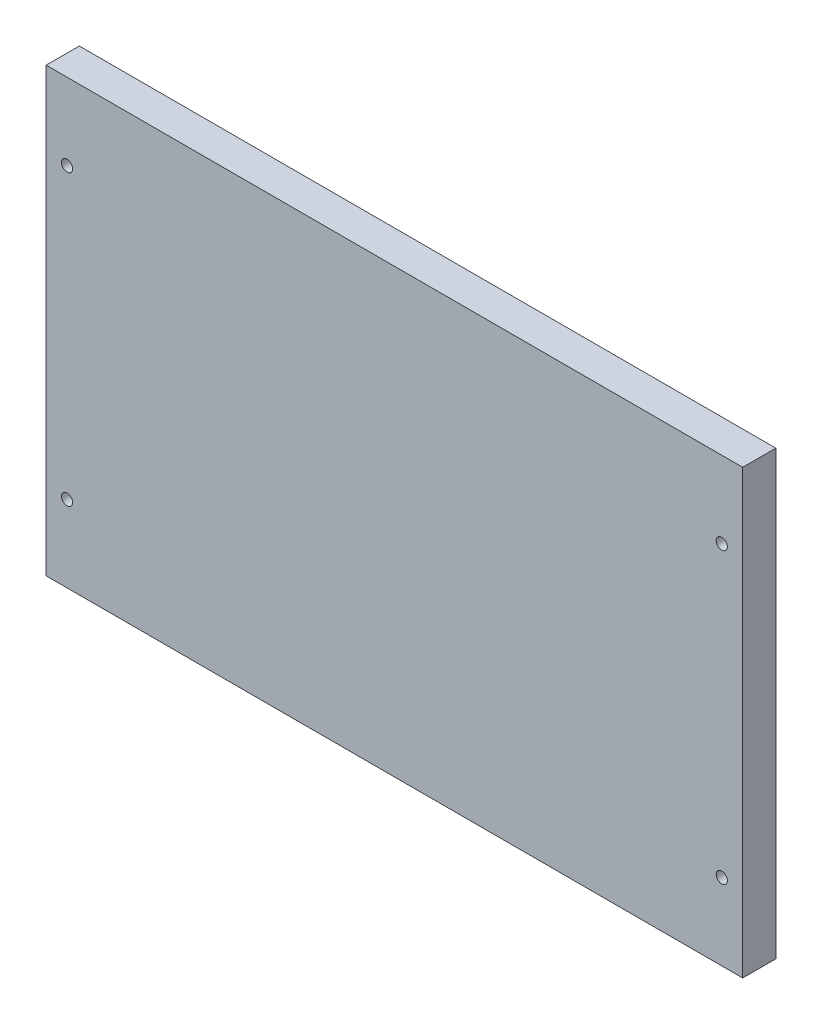
from build123d import *

# Parameters (mm, degrees)
SKETCH1_W  = 200
SKETCH1_H  = 127
SKETCH1_R  = 1.6
WALL_DEPTH = 9.525


with BuildPart() as part:
    # Sketch1 → Wall (new body)
    with BuildSketch(Plane.XY):
        with Locations((100, 63.5)):
            Rectangle(SKETCH1_W, SKETCH1_H)
        with Locations((6, 105)):
            Circle(SKETCH1_R, mode=Mode.SUBTRACT)
        with Locations((6, 22)):
            Circle(SKETCH1_R, mode=Mode.SUBTRACT)
        with Locations((194, 22)):
            Circle(SKETCH1_R, mode=Mode.SUBTRACT)
        with Locations((194, 105)):
            Circle(SKETCH1_R, mode=Mode.SUBTRACT)
    extrude(amount=WALL_DEPTH)


solid = part.part
